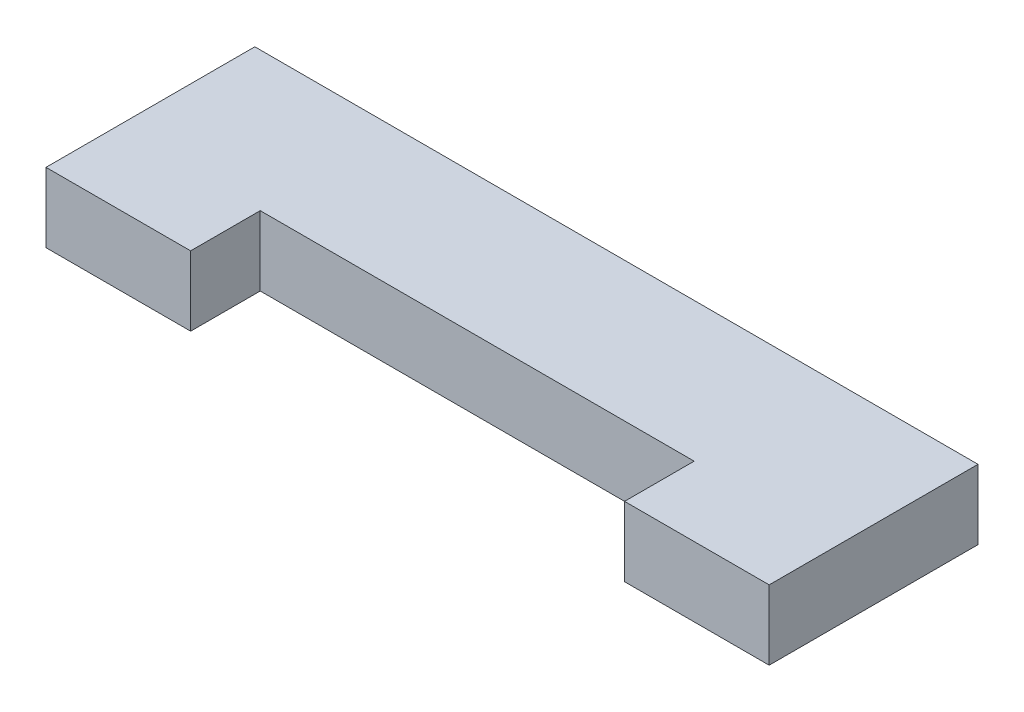
from build123d import *

# Parameters (mm, degrees)
BOSS_EXTRUDE1_DEPTH = 3.85


with BuildPart() as part:
    # Sketch1 → Boss-Extrude1 (new body)
    with BuildSketch(Plane(origin=(0, 0, 0), x_dir=(1, 0, 0), z_dir=(0, 1, 0))):
        Polygon((-20, -3.85), (-20, -7.7), (-12, -7.7), (-12, -3.85), (12, -3.85), (12, -7.7), (20, -7.7), (20, -3.85), (20, 3.85), (-20, 3.85), align=None)
    extrude(amount=BOSS_EXTRUDE1_DEPTH)


solid = part.part
